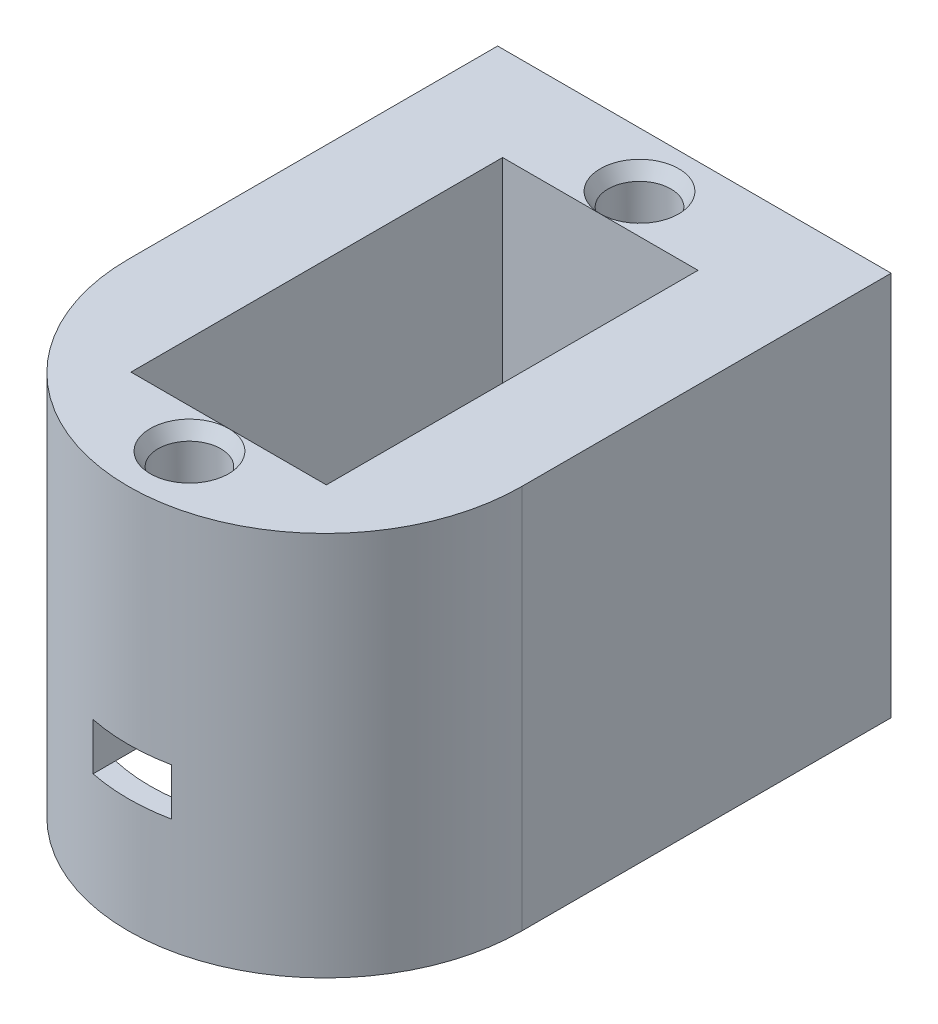
from build123d import *
from OCP.BRepFilletAPI import BRepFilletAPI_MakeChamfer

# Parameters (mm, degrees)
SKETCH4_W                = 12.46
SKETCH4_H                = 17.25
BOSS_EXTRUDE3_DEPTH      = 6
BOSS_EXTRUDE6_DEPTH      = 7.3
BOSS_EXTRUDE6_DEPTH_BACK = 17.25
SKETCH8_R                = 12.546781182
SKETCH8_R_2              = 11.15
BOSS_EXTRUDE4_DEPTH      = 17.25
SKETCH6_R                = 2
CUT_EXTRUDE1_DEPTH       = 5
CHAMFER1_SIZE            = 0.5
CHAMFER1_SIZE_2          = 0.866025404
SKETCH10_W               = 12.46
SKETCH10_H               = 23.7
CUT_EXTRUDE3_DEPTH       = 17.25
CUT_EXTRUDE4_REACH       = 83.955
SKETCH11_W               = 5
SKETCH11_H               = 3
BOSS_EXTRUDE7_START      = -7.3
BOSS_EXTRUDE7_DEPTH      = 7.3


with BuildPart() as part:
    # Sketch4 → Boss-Extrude3 (new body)
    with BuildSketch(Plane.XY):
        with Locations((0, 63.875025481)):
            Rectangle(SKETCH4_W, SKETCH4_H)
    extrude(amount=BOSS_EXTRUDE3_DEPTH)



with BuildPart() as body_2:
    # Sketch8 → Boss-Extrude6 (new, two sides: drawn at the far end of the back side and taken through both)
    with BuildSketch(Plane(origin=(0, 55.250025481, 0), x_dir=(-1, 0, 0), z_dir=(0, -1, 0)).offset(-BOSS_EXTRUDE6_DEPTH_BACK)):
        with Locations(Location((0, -23.55, 0), (0, 0, 90))):
            Circle(SKETCH8_R)
        with Locations(Location((0, -23.55, 0), (0, 0, 90))):
            Circle(SKETCH8_R_2, mode=Mode.SUBTRACT)
    extrude(amount=BOSS_EXTRUDE6_DEPTH + BOSS_EXTRUDE6_DEPTH_BACK)


with BuildPart() as part_1:
    add(part.part)

    add(body_2.part)  # Boss-Extrude4 merges body 2
    # Sketch5 → Boss-Extrude4 (add)
    with BuildSketch(Plane(origin=(0, 72.500025481, 0), x_dir=(1, 0, 0), z_dir=(0, 1, 0))):
        with BuildLine():
            Line((12.546781182, -23.55), (12.546781182, 0))
            Line((12.546781182, 0), (6.23, 0))
            Line((6.23, 0), (6.23, -29.7))
            Line((6.23, -29.7), (-6.23, -29.7))
            Line((-6.23, -29.7), (-6.23, 0))
            Line((-6.23, 0), (-12.546781182, 0))
            Line((-12.546781182, 0), (-12.546781182, -23.55))
            ThreePointArc((-12.546781182, -23.55), (0, -36.096781182), (12.546781182, -23.55))
        make_face()
    extrude(amount=-BOSS_EXTRUDE4_DEPTH)

    # Sketch6 → Cut-Extrude1 (cut)
    with BuildSketch(Plane(origin=(0, 72.500025481, 0), x_dir=(1, 0, 0), z_dir=(0, 1, 0))):
        with Locations(Location((0, -3.5, 0), (0, 0, 270))):
            Circle(SKETCH6_R)
        with Locations(Location((0, -32.2, 0), (0, 0, 270))):
            Circle(SKETCH6_R)
    extrude(amount=-CUT_EXTRUDE1_DEPTH, mode=Mode.SUBTRACT)

    # Chamfer1
    chamfer1_edges_1 = [part_1.edges().sort_by_distance(p)[0] for p in [
        (0, 72.500025481, 1.5),
    ]]
    chamfer1_side_1 = [part_1.faces().sort_by_distance(p)[0] for p in [
        (0, 72.500025481, 1.49),
    ]]
    chamfer1_edges_2 = [part_1.edges().sort_by_distance(p)[0] for p in [
        (0, 72.500025481, 30.2),
    ]]
    chamfer1_side_2 = [part_1.faces().sort_by_distance(p)[0] for p in [
        (0, 72.500025481, 30.19),
    ]]
    chamfer1 = BRepFilletAPI_MakeChamfer(part_1.part.solid().wrapped)
    for e in chamfer1_edges_1:
        chamfer1.Add(CHAMFER1_SIZE - 0.0001, CHAMFER1_SIZE_2 - 0.0001, e.wrapped, chamfer1_side_1[0].wrapped)
    for e in chamfer1_edges_2:
        chamfer1.Add(CHAMFER1_SIZE - 0.0001, CHAMFER1_SIZE_2 - 0.0001, e.wrapped, chamfer1_side_2[0].wrapped)
    add(Compound.cast(chamfer1.Shape()), mode=Mode.REPLACE)  # a hair under: the kernel refuses the full size

    # Sketch10 → Cut-Extrude3 (cut)
    with BuildSketch(Plane(origin=(0, 72.500025481, 0), x_dir=(1, 0, 0), z_dir=(0, 1, 0))):
        with Locations((0, -17.85)):
            Rectangle(SKETCH10_W, SKETCH10_H)
    extrude(amount=-CUT_EXTRUDE3_DEPTH, mode=Mode.SUBTRACT)

    # Sketch11 → Cut-Extrude4 (cut, up to next)
    with BuildSketch(Plane.XY.offset(36.096781182), mode=Mode.PRIVATE) as cut_extrude4_sk1:
        with Locations((0, 56.750025481)):
            Rectangle(SKETCH11_W, SKETCH11_H)
    cut_extrude4_tool1 = extrude(cut_extrude4_sk1.sketch, amount=-CUT_EXTRUDE4_REACH, mode=Mode.PRIVATE) & part_1.part
    add(cut_extrude4_tool1.solids().sort_by_distance((0, 56.750025, 36.096781))[0], mode=Mode.SUBTRACT)

    # Sketch13 → Boss-Extrude7 (add)
    with BuildSketch(Plane.XZ.offset(-47.950025481).offset(BOSS_EXTRUDE7_START)):
        with BuildLine():
            Line((-12.546781182, 23.55), (-12.546781182, 0))
            Line((-12.546781182, 0), (12.546781182, 0))
            Line((12.546781182, 0), (12.546781182, 23.55))
            ThreePointArc((12.546781182, 23.55), (0, 11.003218818), (-12.546781182, 23.55))
        make_face()
    extrude(amount=BOSS_EXTRUDE7_DEPTH)


solid = part_1.part
